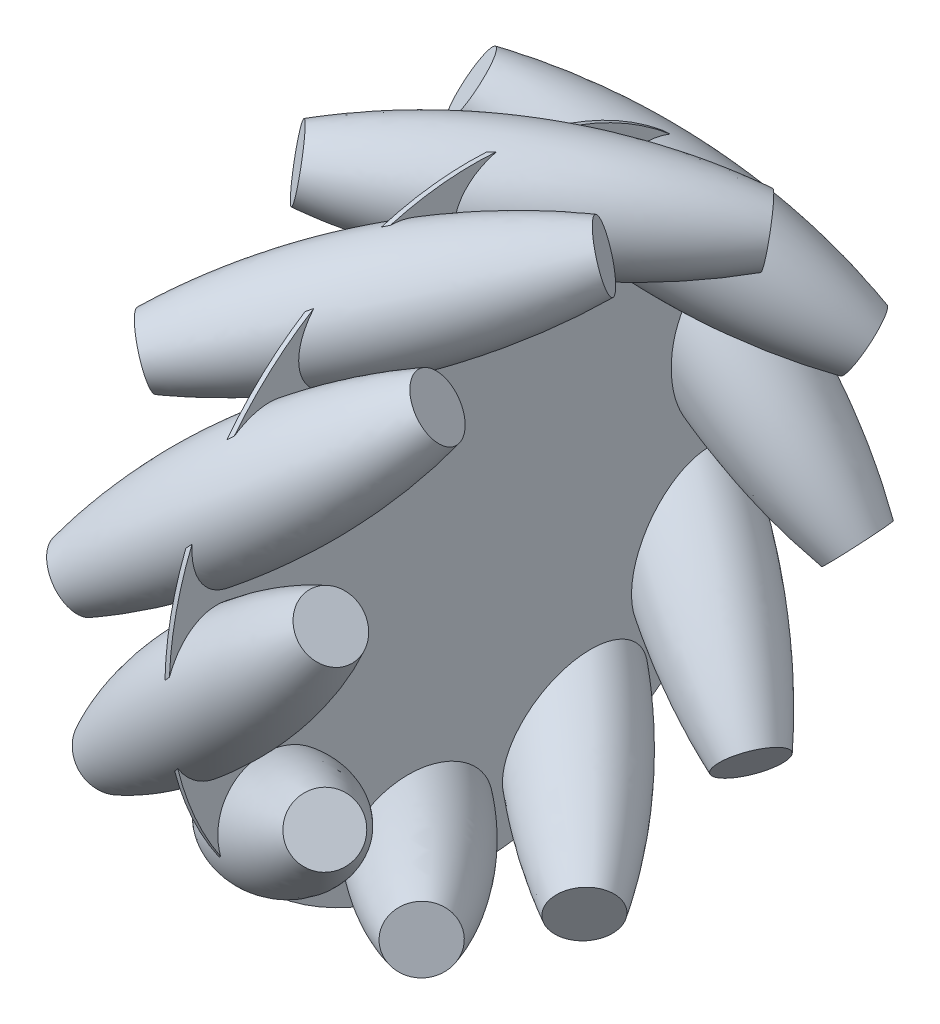
from build123d import *

# Parameters (mm, degrees)
SKETCH_6_R               = 70
EXTRUDE_1_DEPTH          = 0.5
PATTERN_CIRCULAR_2_COUNT = 10


with BuildPart() as part:
    # 草图5 → 旋转1 (revolve)
    with BuildSketch(Plane(origin=(13.19465438, 13.125795331, 1.390430757), x_dir=(0.05281766439045544, 0.05254202441903391, -0.997220953449278), z_dir=(0.7069840571037552, 0.703294513699205, 0.07450080537627188))):
        with BuildLine():
            Line((62.185024099, -54.245593307), (57.84282992, 23.041013906))
            Line((57.84282992, 23.041013906), (65.113941596, 23.449526842))
            add(Edge.make_bspline(
                [(69.111173766, -53.856461375), (78.97533951, -14.587176101), (65.113941596, 23.449526842)],
                knots=[1.169409756, 1.169409756, 1.169409756, 1.97292121, 1.97292121, 1.97292121], degree=2, weights=[1, 0.920375862, 1]))
            Line((69.111173766, -53.856461375), (62.185024099, -54.245593307))
        make_face()
    revolve_1 = revolve(axis=Axis((54.736068112, -22.064522837, -60.621778265), (-0.7071067811865515, 0.7048906770370117, 0.055938657709116456)))

    # 草图6 → 凸台-拉伸1 (add, symmetric)
    with BuildSketch(Plane(origin=(26.398471301, 0, 0), x_dir=(0, 0, -1), z_dir=(1, 0, 0))):
        Circle(SKETCH_6_R)
    extrude(amount=EXTRUDE_1_DEPTH, both=True)

    # 阵列(圆周)2: 旋转1 ×10 about axis
    pattern_circular_2_axis = Axis((0, 0, 0), (1, 0, 0))
    for i in range(1, PATTERN_CIRCULAR_2_COUNT):
        add(revolve_1.rotate(pattern_circular_2_axis, i * 360 / PATTERN_CIRCULAR_2_COUNT))


solid = part.part
